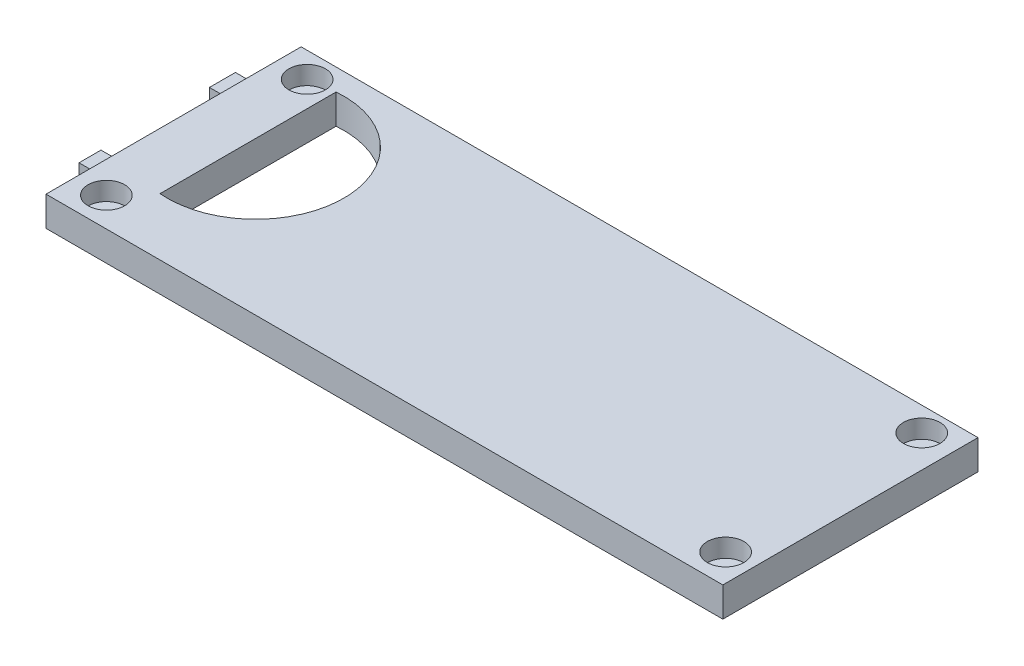
from build123d import *

# Parameters (mm, degrees)
SKETCH1_W           = 114
SKETCH1_H           = 42.97487903
BOSS_EXTRUDE1_DEPTH = 5
SKETCH3_R           = 3.08
CUT_EXTRUDE1_DEPTH  = 3.1
SKETCH5_W           = 4.374782862
SKETCH5_H           = 2
SKETCH5_W_2         = 3.698270048
SKETCH5_H_2         = 2.003550683
BOSS_EXTRUDE2_DEPTH = 3.1
CUT_EXTRUDE7_DEPTH  = 10


with BuildPart() as part:
    # Sketch1 → Boss-Extrude1 (new body)
    with BuildSketch(Plane(origin=(0, 0, 0), x_dir=(1, 0, 0), z_dir=(0, 1, 0))):
        Rectangle(SKETCH1_W, SKETCH1_H)
    extrude(amount=BOSS_EXTRUDE1_DEPTH)

    # Sketch3 → Cut-Extrude1 (cut)
    with BuildSketch(Plane(origin=(0, 5, 0), x_dir=(1, 0, 0), z_dir=(0, 1, 0))):
        with Locations((-51.753086156, 17.246929099)):
            Circle(SKETCH3_R)
        with Locations((-51.753086156, -16.564851847)):
            Circle(SKETCH3_R)
        with Locations((51.584956943, 17.425212087)):
            Circle(SKETCH3_R)
        with Locations((52.43781039, -16.458146722)):
            Circle(SKETCH3_R)
    extrude(amount=-CUT_EXTRUDE1_DEPTH, mode=Mode.SUBTRACT)

    # Sketch5 → Boss-Extrude2 (add)
    with BuildSketch(Plane.ZY.offset(57)):
        with Locations((-11.3256423, 2.70029737)):
            Rectangle(SKETCH5_W, SKETCH5_H)
        with Locations((10.976730125, 2.691921307)):
            Rectangle(SKETCH5_W_2, SKETCH5_H_2)
    extrude(amount=BOSS_EXTRUDE2_DEPTH)

    # Sketch13 → Cut-Extrude7 (cut)
    with BuildSketch(Plane.XZ):
        with BuildLine():
            ThreePointArc((-47.469156219, -17.83966344), (-31.323650484, -3.010124636), (-47.469156219, 11.819414167))
            Line((-47.469156219, 11.819414167), (-47.469156219, -17.83966344))
        make_face()
    extrude(amount=-CUT_EXTRUDE7_DEPTH, mode=Mode.SUBTRACT)


solid = part.part
